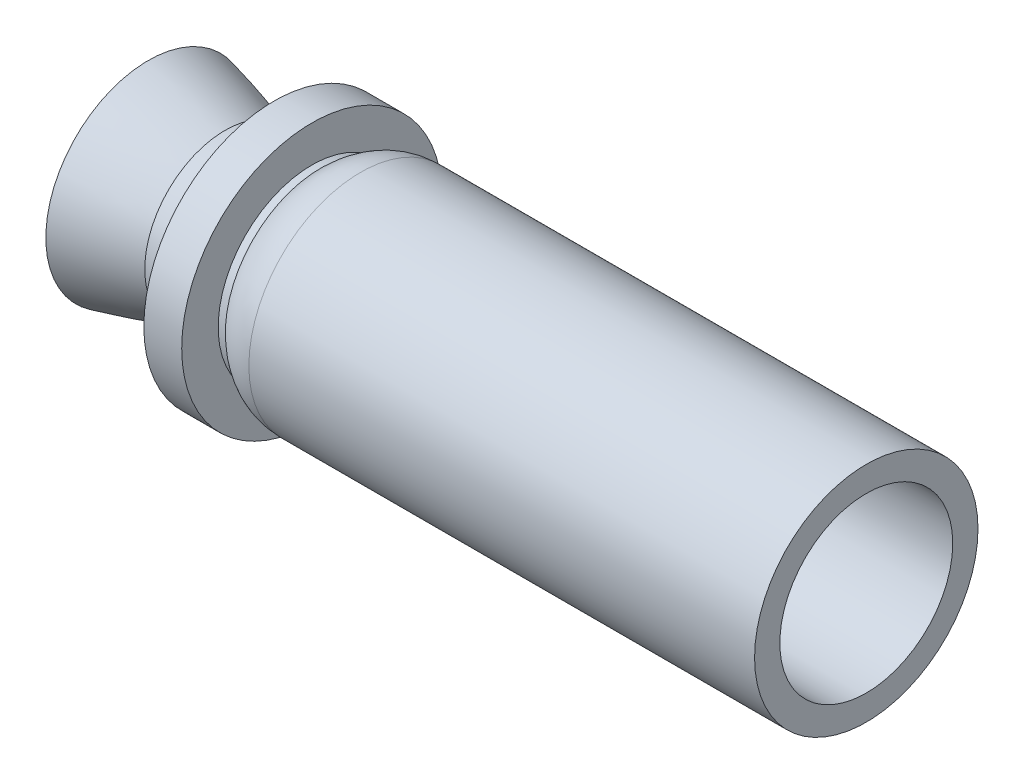
from build123d import *


with BuildPart() as part:
    # Sketch1 → Revolve1 (revolve)
    with BuildSketch(Plane.XY):
        with BuildLine():
            Line((28.949236933, 27.386004017), (189.133015331, 27.386004017))
            Line((189.133015331, 27.386004017), (189.133015331, 35.386004017))
            Line((189.133015331, 35.386004017), (28.949236933, 35.386004017))
            ThreePointArc((28.949236933, 35.386004017), (22.060935151, 34.015835602), (16.221314872, 30.113926078))
            Line((16.221314872, 30.113926078), (-13.981586934, 25.437652311))
            add(Edge.make_bspline(
                [(-13.981586934, 25.437652311), (-16.029314719, 26.139512712), (-28.160190772, 30.070121673), (-38.315022829, 32.432092239)],
                knots=[0.414468937, 0.414468937, 0.414468937, 0.513462719, 1, 1, 1], degree=2))
            Line((-38.315022829, 32.432092239), (-40.127010283, 24.64))
            add(Edge.make_bspline(
                [(0, 11.536137468), (-19.948257354, 19.947595697), (-40.127010283, 24.64)],
                knots=[0, 0, 0, 1, 1, 1], degree=2))
            ThreePointArc((0, 11.536137468), (0.81433228, 11.284876268), (1.662309445, 11.2))
            ThreePointArc((1.662309445, 11.2), (8.091391109, 12.478823854), (13.541703369, 16.120606076))
            Line((13.541703369, 16.120606076), (21.878169121, 24.457071829))
            ThreePointArc((21.878169121, 24.457071829), (25.12240261, 26.624799342), (28.949236933, 27.386004017))
        make_face()
    revolve(axis=Axis((0, 0, 0), (-1, 0, 0)))

    # Sketch3 → Revolve2 (revolve)
    with BuildSketch(Plane.XY):
        with BuildLine():
            Line((7.884849119, 21.777460326), (13.541703369, 27.434314575))
            Line((13.541703369, 27.434314575), (13.541703369, 41.25))
            Line((13.541703369, 41.25), (1.541703369, 41.25))
            Line((1.541703369, 41.25), (1.541703369, 19.562467336))
            add(Edge.make_bspline(
                [(2.348184674, 19.226769399), (1.945008818, 19.395347937), (1.541703369, 19.562467336)],
                knots=[0.018493807, 0.018493807, 0.018493807, 0.038110015, 0.038110015, 0.038110015], degree=2))
            ThreePointArc((2.348184674, 19.226769399), (5.344435892, 20.007381854), (7.884849119, 21.777460326))
        make_face()
    revolve(axis=Axis((0, 0, 0), (-1, 0, 0)))


with BuildPart() as body_2:
    # Split1: the piece on the far side of the plane
    add(part.part)
    split(bisect_by=Plane(origin=(13.541703369, 0, 0), x_dir=(0, 0, 1), z_dir=(1, 0, 0)), keep=Keep.BOTTOM)


with BuildPart() as part_1:
    add(part.part)

    # Split1
    split(bisect_by=Plane(origin=(13.541703369, 0, 0), x_dir=(0, 0, 1), z_dir=(1, 0, 0)), keep=Keep.TOP)


solid = Compound([body_2.part, part_1.part])
